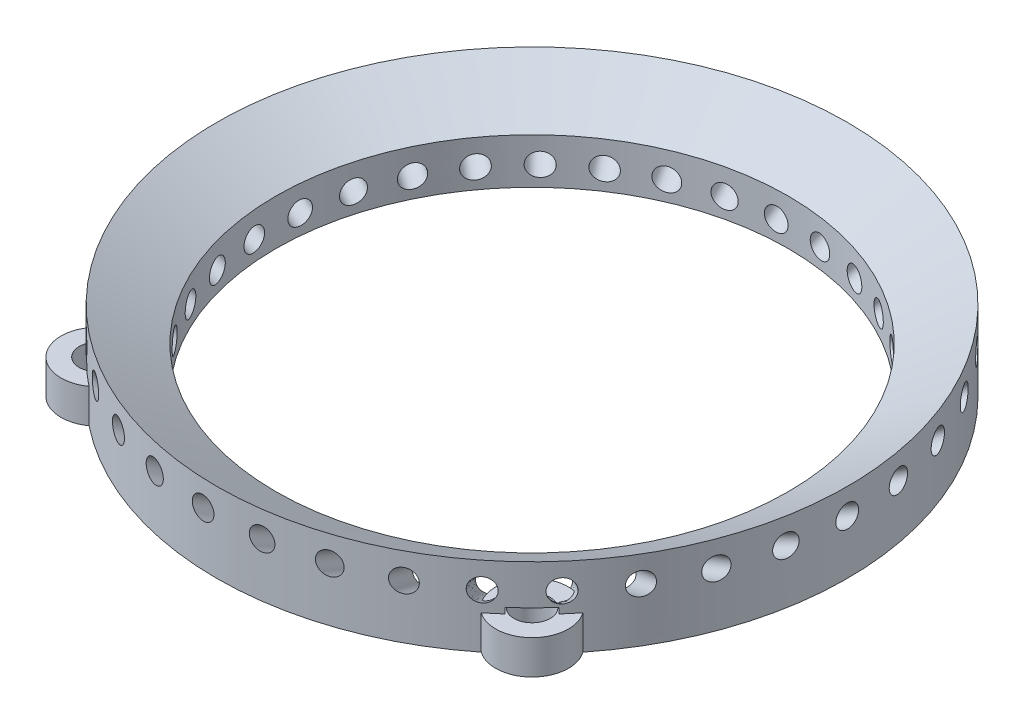
from build123d import *

# Parameters (mm, degrees)
CROQUIS3_R              = 1
CORTAR_EXTRUIR1_DEPTH   = 9.499999612
MATRIZC1_COUNT          = 35
CROQUIS5_R              = 1.8
CORTAR_EXTRUIR2_DEPTH   = 3.5
CROQUIS6_R              = 3.2
CROQUIS6_R_2            = 1.6
SALIENTE_EXTRUIR1_DEPTH = 3


with BuildPart() as part:
    # Croquis2 → Revolución1 (revolve)
    with BuildSketch(Plane.XY, mode=Mode.PRIVATE) as revoluci_n1_sk:
        Polygon((-22.5, 0), (-22.5, 1), (-22.5, 4), (-27.7, 7.0022214), (-27.7, 0), align=None)
    revolve(revoluci_n1_sk.sketch.rotate(Axis((0, 0, 0), (0, 1, 0)), 270), axis=Axis((0, 0, 0), (0, 1, 0)))

    # Croquis3 → Cortar-Extruir1 (cut, along a direction that is not the sketch's normal)
    with BuildSketch(Plane(origin=(27.7, 0, 0), x_dir=(0, 0, -1), z_dir=(1, 0, 0))):
        with Locations((0, 4.75)):
            Circle(CROQUIS3_R)
    cortar_extruir1 = extrude(amount=-CORTAR_EXTRUIR1_DEPTH, dir=(0.8660254037844418, 0.49999999999999456, 0), mode=Mode.SUBTRACT)

    # MatrizC1: Cortar-Extruir1 ×35 about axis
    matrizc1_axis = Axis((0, 0, 0), (0, -1, 0))
    for i in range(1, MATRIZC1_COUNT):
        add(cortar_extruir1.rotate(matrizc1_axis, i * 360 / MATRIZC1_COUNT), mode=Mode.SUBTRACT)

    # Croquis5 → Cortar-Extruir2 (cut)
    with BuildSketch(Plane.XZ):
        with Locations(Location((0, -25.1, 0), (0, 0, 270))):
            Circle(CROQUIS5_R)
        with Locations(Location((-23.586284782, -8.584705597, 0), (0, 0, 270))):
            Circle(CROQUIS5_R)
        with Locations((-19.091883092, 19.091883092)):
            Circle(CROQUIS5_R)
        with Locations((19.091883092, 19.091883092)):
            Circle(CROQUIS5_R)
        with Locations(Location((23.586284782, -8.584705597, 0), (0, 0, 303.400169111))):
            Circle(CROQUIS5_R)
    extrude(amount=-CORTAR_EXTRUIR2_DEPTH, mode=Mode.SUBTRACT)

    # Croquis6 → Saliente-Extruir1 (add)
    # profile 1 of 2: a face of its own
    with BuildSketch(Plane.XZ):
        with Locations((-19.091883092, 19.091883092)):
            Circle(CROQUIS6_R)
        with Locations(Location((-19.091883092, 19.091883092, 0), (0, 0, 270))):
            Circle(CROQUIS6_R_2, mode=Mode.SUBTRACT)
    # profile 2 of 2: a face of its own
    with BuildSketch(Plane.XZ):
        with Locations((19.091883092, 19.091883092)):
            Circle(CROQUIS6_R)
        with Locations(Location((19.091883092, 19.091883092, 0), (0, 0, 90))):
            Circle(CROQUIS6_R_2, mode=Mode.SUBTRACT)
    extrude(amount=-SALIENTE_EXTRUIR1_DEPTH)


solid = part.part
